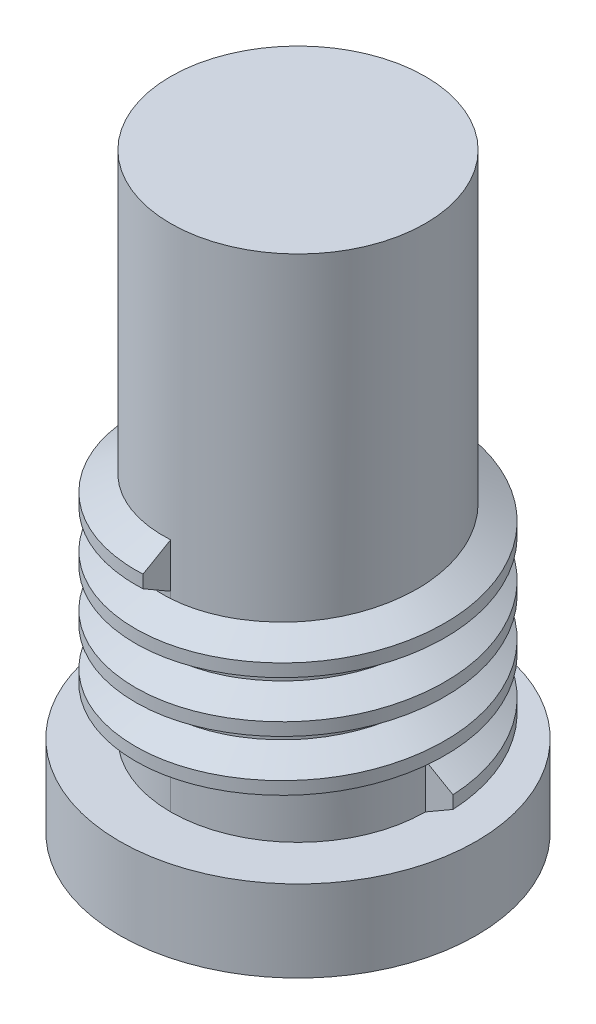
from build123d import *
from build123d.topology import SkipClean

# Parameters (mm, degrees)
SKETCH2_R           = 3.175
BOSS_EXTRUDE1_DEPTH = 12.7
SKETCH3_R           = 4.445
BOSS_EXTRUDE2_DEPTH = 2.032
THREAD1_PITCH       = 1.27


with BuildPart() as part:
    # Sketch2 → Boss-Extrude1 (new body)
    with BuildSketch(Plane(origin=(0, 0, 0), x_dir=(1, 0, 0), z_dir=(0, 1, 0))):
        with Locations(Location((0, 0, 0), (0, 0, 270))):
            Circle(SKETCH2_R)
    extrude(amount=BOSS_EXTRUDE1_DEPTH)

    # Sketch3 → Boss-Extrude2 (add)
    with BuildSketch(Plane(origin=(0, 0, 0), x_dir=(-1, 0, 0), z_dir=(0, -1, 0))):
        with Locations(Location((0, 0, 0), (0, 0, 90))):
            Circle(SKETCH3_R)
    extrude(amount=BOSS_EXTRUDE2_DEPTH)

    # Thread1: the profile of Thread Profile1 profile screwed along a right-hand helix of 3.75 turns, 8 arcs to a turn; built about Z, then put on its axis
    with SkipClean():  # the faces are left unmerged after this step: merging them gives an invalid solid
        thread1_z = Axis((0, 0, 0), (0, 0, 1))
        thread1_corners = [(3.1747, 0, -0.000173205), (3.1747, 0, 1.111423202), (3.862407661, 0, 0.714374998), (3.862407661, 0, 0.396874998)]
        with BuildLine(mode=Mode.PRIVATE) as thread1_profile:
            Line(thread1_corners[0], thread1_corners[1])
            Line(thread1_corners[1], thread1_corners[2])
            Line(thread1_corners[2], thread1_corners[3])
            Line(thread1_corners[3], thread1_corners[0])
        thread1_cap = Face(thread1_profile.wire())
        thread1_turn_angles = [0, 22.5, 45, 67.5, 90, 112.5, 135, 157.5, 180, 202.5, 225, 247.5, 270, 292.5, 315, 337.5, 360]
        thread1_turn_weights = [1, 0.9238795325112867, 1, 0.9238795325112867, 1, 0.9238795325112867, 1, 0.9238795325112867, 1, 0.9238795325112867, 1, 0.9238795325112867, 1, 0.9238795325112867, 1, 0.9238795325112867, 1]
        thread1_turn_rails = [Edge.make_bspline([Vector(p[0], p[1], 0).rotate(thread1_z, thread1_turn_angles[k]) / thread1_turn_weights[k] + Vector(0, 0, p[2] + THREAD1_PITCH * thread1_turn_angles[k] / 360) for k in range(17)], [0, 0, 0, 1, 1, 2, 2, 3, 3, 4, 4, 5, 5, 6, 6, 7, 7, 8, 8, 8], 2, thread1_turn_weights) for p in thread1_corners]
        thread1_turn_sides = [Face.make_surface_from_curves(thread1_turn_rails[p[0]], thread1_turn_rails[p[1]]) for p in [(0, 1), (1, 2), (2, 3), (3, 0)]]
        thread1_last_angles = [1080, 1102.5, 1125, 1147.5, 1170, 1192.5, 1215, 1237.5, 1260, 1282.5, 1305, 1327.5, 1350]
        thread1_last_weights = [1, 0.9238795325112867, 1, 0.9238795325112867, 1, 0.9238795325112867, 1, 0.9238795325112867, 1, 0.9238795325112867, 1, 0.9238795325112867, 1]
        thread1_last_rails = [Edge.make_bspline([Vector(p[0], p[1], 0).rotate(thread1_z, thread1_last_angles[k]) / thread1_last_weights[k] + Vector(0, 0, p[2] + THREAD1_PITCH * thread1_last_angles[k] / 360) for k in range(13)], [0, 0, 0, 1, 1, 2, 2, 3, 3, 4, 4, 5, 5, 6, 6, 6], 2, thread1_last_weights) for p in thread1_corners]
        thread1_last_sides = [Face.make_surface_from_curves(thread1_last_rails[p[0]], thread1_last_rails[p[1]]) for p in [(0, 1), (1, 2), (2, 3), (3, 0)]]
        thread1 = Plane(origin=(0, 0, 0), x_dir=(1, 0, 0), z_dir=(0, 1, 0)) * Solid(Shell([*[p.moved(Location((0, 0, THREAD1_PITCH * i))) for i in range(3) for p in thread1_turn_sides], *thread1_last_sides, thread1_cap, thread1_cap.rotate(thread1_z, 1350).moved(Location((0, 0, THREAD1_PITCH * 1350 / 360)))]))
        add(thread1)


solid = part.part
